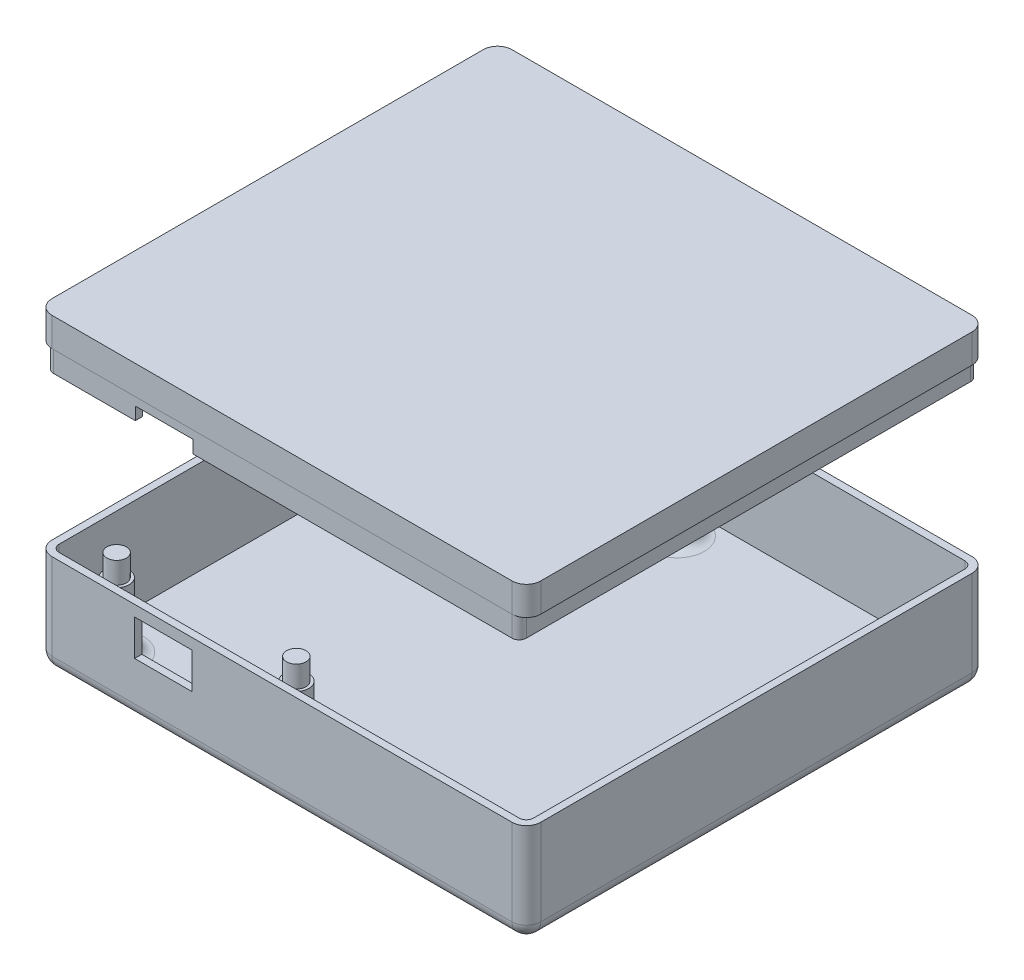
from build123d import *

# Parameters (mm, degrees)
SKETCH1_W                = 68
SKETCH1_H                = 64
SKETCH1_W_2              = 66
SKETCH1_H_2              = 62
EXTRUDE_THIN1_DEPTH      = 14
SKETCH1_2_W              = 66
SKETCH1_2_H              = 62
BOSS_EXTRUDE1_DEPTH      = 1
SKETCH3_R                = 1.75
BOSS_EXTRUDE2_DEPTH      = 9
SKETCH5_R                = 1.75
BOSS_EXTRUDE3_DEPTH      = 9
SKETCH7_R                = 1.35
BOSS_EXTRUDE4_DEPTH      = 3
SKETCH8_R                = 1.35
BOSS_EXTRUDE5_DEPTH      = 3
FILLET2_R                = 2
FILLET3_R                = 2
FILLET4_R                = 2
FILLET3_OF_MIRROR1_R     = 2
FILLET4_OF_MIRROR1_R     = 2
CUT_EXTRUDE1_START       = 2
SKETCH14_W               = 8
SKETCH14_H               = 5
CUT_EXTRUDE1_DEPTH       = 126.5
FILLET7_R                = 1
BOSS_EXTRUDE9_DEPTH      = 4
BOSS_EXTRUDE9_DEPTH_BACK = 0.01
BOSS_EXTRUDE9_START      = 20
SHELL1_T                 = -1
SKETCH25_W               = 65.8
SKETCH25_H               = 63.8
SKETCH25_W_2             = 63.8
SKETCH25_H_2             = 61.8
EXTRUDE_THIN5_DEPTH      = 7
FILLET8_R                = 1
SKETCH26_W               = 8
SKETCH26_H               = 1.764767718
CUT_EXTRUDE2_DEPTH       = 10


with BuildPart() as part:
    # Sketch1 → Extrude-Thin1 (new body)
    with BuildSketch(Plane(origin=(0, 0, 0), x_dir=(1, 0, 0), z_dir=(0, 1, 0))):
        Rectangle(SKETCH1_W, SKETCH1_H)
        Rectangle(SKETCH1_W_2, SKETCH1_H_2, mode=Mode.SUBTRACT)
    extrude(amount=EXTRUDE_THIN1_DEPTH)

    # Sketch1<2> → Boss-Extrude1 (add)
    with BuildSketch(Plane(origin=(0, 0, 0), x_dir=(1, 0, 0), z_dir=(0, 1, 0))):
        Rectangle(SKETCH1_2_W, SKETCH1_2_H)
    extrude(amount=BOSS_EXTRUDE1_DEPTH)

    # Sketch3 → Boss-Extrude2 (add)
    with BuildSketch(Plane(origin=(0, 1, 0), x_dir=(1, 0, 0), z_dir=(0, 1, 0))):
        with Locations(Location((-29, 27, 0), (0, 0, 270))):
            Circle(SKETCH3_R)
    boss_extrude2 = extrude(amount=BOSS_EXTRUDE2_DEPTH)

    # Sketch5 → Boss-Extrude3 (add)
    with BuildSketch(Plane(origin=(0, 1, 0), x_dir=(1, 0, 0), z_dir=(0, 1, 0))):
        with Locations(Location((-29, -26, 0), (0, 0, 270))):
            Circle(SKETCH5_R)
    boss_extrude3 = extrude(amount=BOSS_EXTRUDE3_DEPTH)

    # Sketch7 → Boss-Extrude4 (add)
    with BuildSketch(Plane(origin=(0, 10, 0), x_dir=(1, 0, 0), z_dir=(0, 1, 0))):
        with Locations(Location((-29, 27, 0), (0, 0, 270))):
            Circle(SKETCH7_R)
    boss_extrude4 = extrude(amount=BOSS_EXTRUDE4_DEPTH)

    # Sketch8 → Boss-Extrude5 (add)
    with BuildSketch(Plane(origin=(0, 10, 0), x_dir=(1, 0, 0), z_dir=(0, 1, 0))):
        with Locations(Location((-29, -26, 0), (0, 0, 270))):
            Circle(SKETCH8_R)
    boss_extrude5 = extrude(amount=BOSS_EXTRUDE5_DEPTH)

    # Fillet2
    fillet2_edges = [part.edges().sort_by_distance(p)[0] for p in [
        (0, 0, -32),
        (34, 0, 0),
        (0, 0, 32),
        (-34, 0, 0),
        (-34, 7, -32),
        (34, 7, -32),
        (34, 7, 32),
        (-34, 7, 32),
    ]]
    fillet(fillet2_edges, radius=FILLET2_R)

    # Fillet3
    fillet3_edges = [part.edges().sort_by_distance(p)[0] for p in [
        (-29, 1, -28.75),
    ]]
    fillet(fillet3_edges, radius=FILLET3_R)

    # Fillet4
    fillet4_edges = [part.edges().sort_by_distance(p)[0] for p in [
        (-29, 1, 24.25),
    ]]
    fillet(fillet4_edges, radius=FILLET4_R)

    # Mirror1: Boss-Extrude2, Boss-Extrude3, Boss-Extrude4, Boss-Extrude5 across plane
    add(boss_extrude2.mirror(Plane(origin=(-16.5, 0, 0), x_dir=(0, 0, 1), z_dir=(1, 0, 0))))
    add(boss_extrude3.mirror(Plane(origin=(-16.5, 0, 0), x_dir=(0, 0, 1), z_dir=(1, 0, 0))))
    add(boss_extrude4.mirror(Plane(origin=(-16.5, 0, 0), x_dir=(0, 0, 1), z_dir=(1, 0, 0))))
    add(boss_extrude5.mirror(Plane(origin=(-16.5, 0, 0), x_dir=(0, 0, 1), z_dir=(1, 0, 0))))

    # Fillet3 of Mirror1
    fillet3_of_mirror1_edges = [part.edges().sort_by_distance(p)[0] for p in [
        (-4, 1, -28.75),
    ]]
    fillet(fillet3_of_mirror1_edges, radius=FILLET3_OF_MIRROR1_R)

    # Fillet4 of Mirror1
    fillet4_of_mirror1_edges = [part.edges().sort_by_distance(p)[0] for p in [
        (-4, 1, 24.25),
    ]]
    fillet(fillet4_of_mirror1_edges, radius=FILLET4_OF_MIRROR1_R)

    # Sketch14 → Cut-Extrude1 (cut)
    with BuildSketch(Plane.XY.offset(-31).offset(CUT_EXTRUDE1_START)):
        with Locations((-16.5, 9.980975897)):
            Rectangle(SKETCH14_W, SKETCH14_H)
    extrude(amount=CUT_EXTRUDE1_DEPTH, mode=Mode.SUBTRACT)

    # Fillet7
    fillet7_edges = [part.edges().sort_by_distance(p)[0] for p in [
        (-33, 7.5, -31),
        (-33, 7.5, 31),
        (33, 7.5, 31),
        (33, 7.5, -31),
    ]]
    fillet(fillet7_edges, radius=FILLET7_R)


with BuildPart() as body_2:
    # Sketch22 → Boss-Extrude9 (new, two sides: drawn at the far end of the back side and taken through both)
    with BuildSketch(Plane(origin=(0, 1, 0), x_dir=(1, 0, 0), z_dir=(0, 1, 0)).offset(BOSS_EXTRUDE9_START - BOSS_EXTRUDE9_DEPTH_BACK)):
        with BuildLine():
            Line((-34, 30), (-34, -30))
            ThreePointArc((-34, -30), (-33.414213562, -31.414213562), (-32, -32))
            Line((-32, -32), (32, -32))
            ThreePointArc((32, -32), (33.414213562, -31.414213562), (34, -30))
            Line((34, -30), (34, 30))
            ThreePointArc((34, 30), (33.414213562, 31.414213562), (32, 32))
            Line((32, 32), (-32, 32))
            ThreePointArc((-32, 32), (-33.414213562, 31.414213562), (-34, 30))
        make_face()
    extrude(amount=BOSS_EXTRUDE9_DEPTH + BOSS_EXTRUDE9_DEPTH_BACK)

    # Shell1
    shell1_openings = [body_2.faces().sort_by_distance(p)[0] for p in [
        (0, 20.99, 0),
    ]]
    offset(amount=SHELL1_T, openings=shell1_openings, kind=Kind.INTERSECTION)

    # Sketch25 → Extrude-Thin5 (add)
    with BuildSketch(Plane(origin=(0, 25, 0), x_dir=(1, 0, 0), z_dir=(0, 1, 0))):
        Rectangle(SKETCH25_W, SKETCH25_H)
        Rectangle(SKETCH25_W_2, SKETCH25_H_2, mode=Mode.SUBTRACT)
    extrude(amount=-EXTRUDE_THIN5_DEPTH)

    # Fillet8
    # the kernel refuses this fillet: 1 mm, written as the material it takes off along each edge
    with BuildSketch(Plane(origin=(32.9, 27.5, 31.9), x_dir=(0, 0, -1), z_dir=(0, -1, 0))) as fillet8_piece_1_section:
        with BuildLine():
            CenterArc((FILLET8_R, -FILLET8_R), FILLET8_R, 90, 90)
            Line((0, -FILLET8_R), (0, 0))
            Line((0, 0), (FILLET8_R, 0))
        make_face()
    fillet8_piece_1 = extrude(amount=12, mode=Mode.PRIVATE)
    fillet8_piece_1 = fillet8_piece_1 & Plane(origin=(32, 18.245, 30), x_dir=(0, 0, 1), z_dir=(0, -1, 0)) * Cylinder(2, 29, mode=Mode.PRIVATE)
    fillet8_piece_1 = split(fillet8_piece_1, bisect_by=Plane(origin=(32.660150073, 20.99, 31.653243264), z_dir=(0, -1, 0)), keep=Keep.TOP, mode=Mode.PRIVATE)
    add(fillet8_piece_1, mode=Mode.SUBTRACT)
    with BuildSketch(Plane(origin=(32.9, 27.5, 31.9), x_dir=(0, 0, -1), z_dir=(0, -1, 0))) as fillet8_piece_2_section:
        with BuildLine():
            CenterArc((FILLET8_R, -FILLET8_R), FILLET8_R, 90, 90)
            Line((0, -FILLET8_R), (0, 0))
            Line((0, 0), (FILLET8_R, 0))
        make_face()
    fillet8_piece_2 = extrude(amount=12, mode=Mode.PRIVATE)
    fillet8_piece_2 = fillet8_piece_2 - Plane(origin=(32, 24.245, 30), x_dir=(0, 0, 1), z_dir=(0, -1, 0)) * Cylinder(2, 29, mode=Mode.PRIVATE)
    fillet8_piece_2 = split(fillet8_piece_2, bisect_by=Plane(origin=(32.806073039, 20.99, 31.874073412), z_dir=(0, 1, 0)), keep=Keep.TOP, mode=Mode.PRIVATE)
    add(fillet8_piece_2, mode=Mode.SUBTRACT)
    with BuildSketch(Plane(origin=(32.9, 27.5, 31.9), x_dir=(0, 0, -1), z_dir=(0, -1, 0))) as fillet8_piece_3_section:
        with BuildLine():
            CenterArc((FILLET8_R, -FILLET8_R), FILLET8_R, 90, 90)
            Line((0, -FILLET8_R), (0, 0))
            Line((0, 0), (FILLET8_R, 0))
        make_face()
    fillet8_piece_3 = extrude(amount=12, mode=Mode.PRIVATE)
    fillet8_piece_3 = fillet8_piece_3 - Plane(origin=(32, 18.245, 30), x_dir=(0, 0, 1), z_dir=(0, -1, 0)) * Cylinder(2, 29, mode=Mode.PRIVATE)
    fillet8_piece_3 = split(fillet8_piece_3, bisect_by=Plane(origin=(32.806073039, 20.99, 31.874073412), z_dir=(0, -1, 0)), keep=Keep.TOP, mode=Mode.PRIVATE)
    add(fillet8_piece_3, mode=Mode.SUBTRACT)
    with BuildSketch(Plane(origin=(-32.9, 27.5, 31.9), x_dir=(1, 0, 0), z_dir=(0, -1, 0))) as fillet8_piece_4_section:
        with BuildLine():
            CenterArc((FILLET8_R, -FILLET8_R), FILLET8_R, 90, 90)
            Line((0, -FILLET8_R), (0, 0))
            Line((0, 0), (FILLET8_R, 0))
        make_face()
    fillet8_piece_4 = extrude(amount=12, mode=Mode.PRIVATE)
    fillet8_piece_4 = fillet8_piece_4 & Plane(origin=(-32, 18.245, 30), x_dir=(-1, 0, 0), z_dir=(0, -1, 0)) * Cylinder(2, 28, mode=Mode.PRIVATE)
    fillet8_piece_4 = split(fillet8_piece_4, bisect_by=Plane(origin=(-32.660150073, 20.99, 31.653243264), z_dir=(0, -1, 0)), keep=Keep.TOP, mode=Mode.PRIVATE)
    add(fillet8_piece_4, mode=Mode.SUBTRACT)
    with BuildSketch(Plane(origin=(-32.9, 27.5, 31.9), x_dir=(1, 0, 0), z_dir=(0, -1, 0))) as fillet8_piece_5_section:
        with BuildLine():
            CenterArc((FILLET8_R, -FILLET8_R), FILLET8_R, 90, 90)
            Line((0, -FILLET8_R), (0, 0))
            Line((0, 0), (FILLET8_R, 0))
        make_face()
    fillet8_piece_5 = extrude(amount=12, mode=Mode.PRIVATE)
    fillet8_piece_5 = fillet8_piece_5 - Plane(origin=(-32, 24.245, 30), x_dir=(-1, 0, 0), z_dir=(0, -1, 0)) * Cylinder(2, 28, mode=Mode.PRIVATE)
    fillet8_piece_5 = split(fillet8_piece_5, bisect_by=Plane(origin=(-32.806073039, 20.99, 31.874073412), z_dir=(0, 1, 0)), keep=Keep.TOP, mode=Mode.PRIVATE)
    add(fillet8_piece_5, mode=Mode.SUBTRACT)
    with BuildSketch(Plane(origin=(-32.9, 27.5, 31.9), x_dir=(1, 0, 0), z_dir=(0, -1, 0))) as fillet8_piece_6_section:
        with BuildLine():
            CenterArc((FILLET8_R, -FILLET8_R), FILLET8_R, 90, 90)
            Line((0, -FILLET8_R), (0, 0))
            Line((0, 0), (FILLET8_R, 0))
        make_face()
    fillet8_piece_6 = extrude(amount=12, mode=Mode.PRIVATE)
    fillet8_piece_6 = fillet8_piece_6 - Plane(origin=(-32, 18.245, 30), x_dir=(-1, 0, 0), z_dir=(0, -1, 0)) * Cylinder(2, 28, mode=Mode.PRIVATE)
    fillet8_piece_6 = split(fillet8_piece_6, bisect_by=Plane(origin=(-32.806073039, 20.99, 31.874073412), z_dir=(0, -1, 0)), keep=Keep.TOP, mode=Mode.PRIVATE)
    add(fillet8_piece_6, mode=Mode.SUBTRACT)
    with BuildSketch(Plane(origin=(-32.9, 27.5, -31.9), x_dir=(1, 0, 0), z_dir=(0, -1, 0))) as fillet8_piece_7_section:
        with BuildLine():
            CenterArc((FILLET8_R, FILLET8_R), FILLET8_R, 180, 90)
            Line((0, FILLET8_R), (0, 0))
            Line((0, 0), (FILLET8_R, 0))
        make_face()
    fillet8_piece_7 = extrude(amount=12, mode=Mode.PRIVATE)
    fillet8_piece_7 = split(fillet8_piece_7, bisect_by=Plane(origin=(-32.660150073, 20.99, -31.653243264), z_dir=(0, -1, 0)), keep=Keep.TOP, mode=Mode.PRIVATE)
    fillet8_piece_7 = fillet8_piece_7 & Plane(origin=(-32, 18.245, -30), x_dir=(0, 0, -1), z_dir=(0, -1, 0)) * Cylinder(2, 28, mode=Mode.PRIVATE)
    add(fillet8_piece_7, mode=Mode.SUBTRACT)
    with BuildSketch(Plane(origin=(-32.9, 27.5, -31.9), x_dir=(1, 0, 0), z_dir=(0, -1, 0))) as fillet8_piece_8_section:
        with BuildLine():
            CenterArc((FILLET8_R, FILLET8_R), FILLET8_R, 180, 90)
            Line((0, FILLET8_R), (0, 0))
            Line((0, 0), (FILLET8_R, 0))
        make_face()
    fillet8_piece_8 = extrude(amount=12, mode=Mode.PRIVATE)
    fillet8_piece_8 = split(fillet8_piece_8, bisect_by=Plane(origin=(-32.806073039, 20.99, -31.874073412), z_dir=(0, 1, 0)), keep=Keep.TOP, mode=Mode.PRIVATE)
    fillet8_piece_8 = fillet8_piece_8 - Plane(origin=(-32, 24.245, -30), x_dir=(0, 0, -1), z_dir=(0, -1, 0)) * Cylinder(2, 28, mode=Mode.PRIVATE)
    add(fillet8_piece_8, mode=Mode.SUBTRACT)
    with BuildSketch(Plane(origin=(-32.9, 27.5, -31.9), x_dir=(1, 0, 0), z_dir=(0, -1, 0))) as fillet8_piece_9_section:
        with BuildLine():
            CenterArc((FILLET8_R, FILLET8_R), FILLET8_R, 180, 90)
            Line((0, FILLET8_R), (0, 0))
            Line((0, 0), (FILLET8_R, 0))
        make_face()
    fillet8_piece_9 = extrude(amount=12, mode=Mode.PRIVATE)
    fillet8_piece_9 = split(fillet8_piece_9, bisect_by=Plane(origin=(-32.806073039, 20.99, -31.874073412), z_dir=(0, -1, 0)), keep=Keep.TOP, mode=Mode.PRIVATE)
    fillet8_piece_9 = fillet8_piece_9 - Plane(origin=(-32, 18.245, -30), x_dir=(0, 0, -1), z_dir=(0, -1, 0)) * Cylinder(2, 28, mode=Mode.PRIVATE)
    add(fillet8_piece_9, mode=Mode.SUBTRACT)
    with BuildSketch(Plane(origin=(32.9, 27.5, -31.9), x_dir=(0, 0, 1), z_dir=(0, -1, 0))) as fillet8_piece_10_section:
        with BuildLine():
            CenterArc((FILLET8_R, FILLET8_R), FILLET8_R, 180, 90)
            Line((0, FILLET8_R), (0, 0))
            Line((0, 0), (FILLET8_R, 0))
        make_face()
    fillet8_piece_10 = extrude(amount=12, mode=Mode.PRIVATE)
    fillet8_piece_10 = fillet8_piece_10 & Plane(origin=(32, 18.245, -30), x_dir=(1, 0, 0), z_dir=(0, -1, 0)) * Cylinder(2, 28, mode=Mode.PRIVATE)
    fillet8_piece_10 = split(fillet8_piece_10, bisect_by=Plane(origin=(32.660150073, 20.99, -31.653243264), z_dir=(0, -1, 0)), keep=Keep.TOP, mode=Mode.PRIVATE)
    add(fillet8_piece_10, mode=Mode.SUBTRACT)
    with BuildSketch(Plane(origin=(32.9, 27.5, -31.9), x_dir=(0, 0, 1), z_dir=(0, -1, 0))) as fillet8_piece_11_section:
        with BuildLine():
            CenterArc((FILLET8_R, FILLET8_R), FILLET8_R, 180, 90)
            Line((0, FILLET8_R), (0, 0))
            Line((0, 0), (FILLET8_R, 0))
        make_face()
    fillet8_piece_11 = extrude(amount=12, mode=Mode.PRIVATE)
    fillet8_piece_11 = fillet8_piece_11 - Plane(origin=(32, 24.245, -30), x_dir=(1, 0, 0), z_dir=(0, -1, 0)) * Cylinder(2, 28, mode=Mode.PRIVATE)
    fillet8_piece_11 = split(fillet8_piece_11, bisect_by=Plane(origin=(32.806073039, 20.99, -31.874073412), z_dir=(0, 1, 0)), keep=Keep.TOP, mode=Mode.PRIVATE)
    add(fillet8_piece_11, mode=Mode.SUBTRACT)
    with BuildSketch(Plane(origin=(32.9, 27.5, -31.9), x_dir=(0, 0, 1), z_dir=(0, -1, 0))) as fillet8_piece_12_section:
        with BuildLine():
            CenterArc((FILLET8_R, FILLET8_R), FILLET8_R, 180, 90)
            Line((0, FILLET8_R), (0, 0))
            Line((0, 0), (FILLET8_R, 0))
        make_face()
    fillet8_piece_12 = extrude(amount=12, mode=Mode.PRIVATE)
    fillet8_piece_12 = fillet8_piece_12 - Plane(origin=(32, 18.245, -30), x_dir=(1, 0, 0), z_dir=(0, -1, 0)) * Cylinder(2, 28, mode=Mode.PRIVATE)
    fillet8_piece_12 = split(fillet8_piece_12, bisect_by=Plane(origin=(32.806073039, 20.99, -31.874073412), z_dir=(0, -1, 0)), keep=Keep.TOP, mode=Mode.PRIVATE)
    add(fillet8_piece_12, mode=Mode.SUBTRACT)


with BuildPart() as body_2_1:
    # Body-Move/Copy7: moved
    add(body_2.part.moved(Location((0, 18.076186277, 0))))

    # Sketch26 → Cut-Extrude2 (cut)
    with BuildSketch(Plane.XY.offset(31.9)):
        with Locations((-16.5, 36.958570136)):
            Rectangle(SKETCH26_W, SKETCH26_H)
    extrude(amount=-CUT_EXTRUDE2_DEPTH, mode=Mode.SUBTRACT)


solid = Compound([part.part, body_2_1.part])
